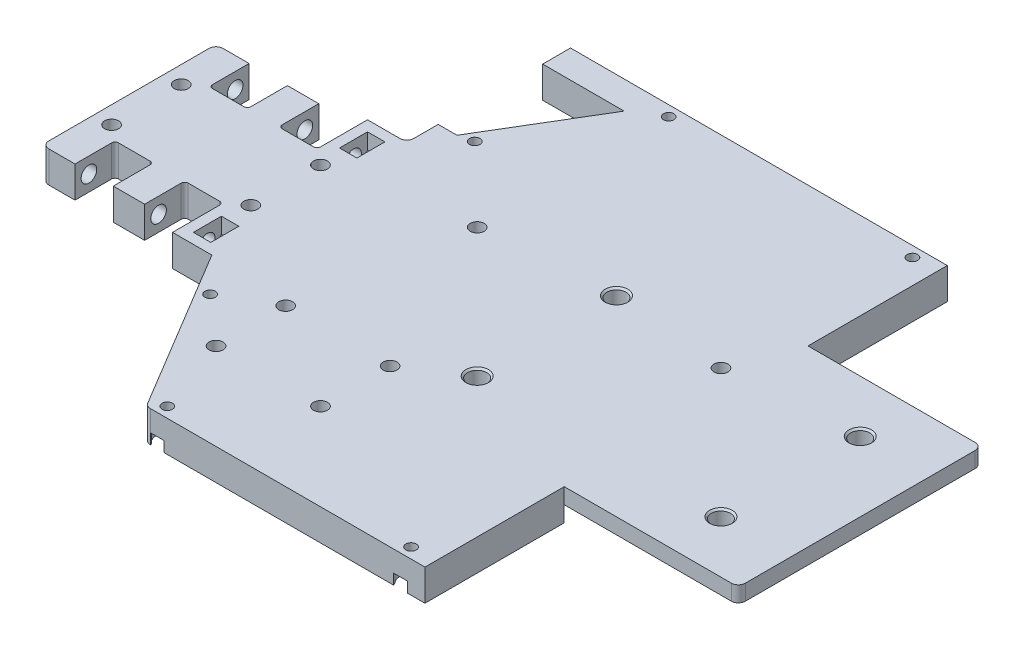
from build123d import *

# Parameters (mm, degrees)
BOSS_EXTRUDE1_DEPTH      = 9
SKETCH3_R                = 2
CUT_EXTRUDE1_DEPTH       = 112.488030158
SKETCH4_W                = 70
SKETCH4_H                = 4.5
BOSS_EXTRUDE2_DEPTH      = 50
SKETCH5_W                = 70
SKETCH5_H                = 4.5
CUT_EXTRUDE2_DEPTH       = 50
SKETCH6_R                = 2.75
CUT_EXTRUDE4_DEPTH       = 50
FILLET1_R                = 2
CHAMFER1_SIZE            = 0.5
FILLET2_R                = 2
SKETCH7_W                = 11
SKETCH7_H                = 11.5
CUT_EXTRUDE5_DEPTH       = 153.08328408
SKETCH8_R                = 2.25
CUT_EXTRUDE6_DEPTH       = 50
SKETCH10_R               = 3.5
CUT_EXTRUDE8_DEPTH       = 4
CUT_EXTRUDE9_START       = -3
CUT_EXTRUDE9_DEPTH       = 5
FILLET4_R                = 1
FILLET4_OF_MIRROR2_R     = 1
SKETCH12_R               = 2
CUT_EXTRUDE10_DEPTH      = 10
SKETCH13_R               = 3.5
CUT_EXTRUDE11_DEPTH      = 3
SKETCH15_R               = 1.5
CUT_EXTRUDE12_DEPTH      = 10
SKETCH17_R               = 3.25
CUT_EXTRUDE14_DEPTH      = 3
CHAMFER2_START           = -1
CHAMFER2_DEPTH           = 4
SKETCH18_W               = 12
SKETCH18_H               = 9
BOSS_EXTRUDE3_DEPTH      = 3
SKETCH20_R               = 2
CUT_EXTRUDE15_DEPTH      = 153.083284086
BOSS_EXTRUDE5_DEPTH      = 3
BOSS_EXTRUDE5_DEPTH_BACK = 26.202556
SKETCH23_W               = 8
SKETCH23_H               = 9
SKETCH23_W_2             = 9
FILLET5_R                = 2
SKETCH24_R               = 3.25
CUT_EXTRUDE17_DEPTH      = 3
SKETCH25_R               = 1.5
CUT_EXTRUDE18_DEPTH      = 152.9352668
SKETCH26_R               = 1.5
CUT_EXTRUDE20_DEPTH      = 5
CHAMFER3_SIZE            = 0.764705882


with BuildPart() as part:
    # Sketch1 → Boss-Extrude1 (new body)
    with BuildSketch(Plane(origin=(0, 0, 0), x_dir=(1, 0, 0), z_dir=(0, 1, 0))):
        Polygon((-78.00255572, 25), (-28.00255572, 25), (1.99744428, 75), (81.99744428, 75), (81.99744428, -75), (1.99744428, -75), (-28.00255572, -25), (-78.00255572, -25), align=None)
    extrude(amount=BOSS_EXTRUDE1_DEPTH)

    # Sketch3 → Cut-Extrude1 (cut, through all)
    with BuildSketch(Plane(origin=(0, 9, 0), x_dir=(1, 0, 0), z_dir=(0, 1, 0))):
        with Locations(Location((-73.00255572, 10, 0), (0, 0, 270))):
            Circle(SKETCH3_R)
        with Locations(Location((-33.00255572, 10, 0), (0, 0, 270))):
            Circle(SKETCH3_R)
        with Locations(Location((-33.00255572, -10, 0), (0, 0, 270))):
            Circle(SKETCH3_R)
        with Locations(Location((-73.00255572, -10, 0), (0, 0, 270))):
            Circle(SKETCH3_R)
    extrude(amount=-CUT_EXTRUDE1_DEPTH, mode=Mode.SUBTRACT)

    # Sketch4 → Boss-Extrude2 (add)
    with BuildSketch(Plane(origin=(81.99744428, 0, 0), x_dir=(0, 0, -1), z_dir=(1, 0, 0))):
        with Locations((0, 6.75)):
            Rectangle(SKETCH4_W, SKETCH4_H)
    extrude(amount=BOSS_EXTRUDE2_DEPTH)

    # Sketch5 → Cut-Extrude2 (cut)
    with BuildSketch(Plane(origin=(81.99744428, 0, 0), x_dir=(0, 0, -1), z_dir=(1, 0, 0))):
        with Locations((0, 2.25)):
            Rectangle(SKETCH5_W, SKETCH5_H)
    extrude(amount=-CUT_EXTRUDE2_DEPTH, mode=Mode.SUBTRACT)

    # Sketch6 → Cut-Extrude4 (cut)
    with BuildSketch(Plane(origin=(0, 9, 0), x_dir=(1, 0, 0), z_dir=(0, 1, 0))):
        with Locations(Location((41.99744428, 20, 0), (0, 0, 270))):
            Circle(SKETCH6_R)
        with Locations(Location((41.99744428, -20, 0), (0, 0, 270))):
            Circle(SKETCH6_R)
        with Locations(Location((111.99744428, 20, 0), (0, 0, 270))):
            Circle(SKETCH6_R)
        with Locations(Location((111.99744428, -20, 0), (0, 0, 270))):
            Circle(SKETCH6_R)
    extrude(amount=-CUT_EXTRUDE4_DEPTH, mode=Mode.SUBTRACT)

    # Fillet1
    fillet1_edges = [part.edges().sort_by_distance(p)[0] for p in [
        (1.99744428, 4.5, 75),
        (-28.00255572, 4.5, 25),
        (-78.00255572, 4.5, 25),
        (-78.00255572, 4.5, -25),
        (-28.00255572, 4.5, -25),
        (1.99744428, 4.5, -75),
    ]]
    fillet(fillet1_edges, radius=FILLET1_R)

    # Chamfer1
    chamfer1_edges = [part.edges().sort_by_distance(p)[0] for p in [
        (41.99744428, 9, 17.25),
        (111.99744428, 9, -22.75),
        (111.99744428, 9, 17.25),
        (41.99744428, 9, -22.75),
    ]]
    chamfer(chamfer1_edges, length=CHAMFER1_SIZE)

    # Fillet2
    fillet2_edges = [part.edges().sort_by_distance(p)[0] for p in [
        (131.99744428, 6.75, 35),
        (131.99744428, 6.75, -35),
    ]]
    fillet(fillet2_edges, radius=FILLET2_R)

    # Sketch7 → Cut-Extrude5 (cut, through all)
    with BuildSketch(Plane(origin=(0, 9, 0), x_dir=(1, 0, 0), z_dir=(0, 1, 0))):
        with Locations((-63.00255572, -19.25)):
            Rectangle(SKETCH7_W, SKETCH7_H)
        with Locations((-43.00255572, -19.25)):
            Rectangle(SKETCH7_W, SKETCH7_H)
    cut_extrude5 = extrude(amount=-CUT_EXTRUDE5_DEPTH, mode=Mode.SUBTRACT)

    # Sketch8 → Cut-Extrude6 (cut)
    with BuildSketch(Plane.ZY.offset(78.00255572)):
        with Locations((21, 4.5)):
            Circle(SKETCH8_R)
    cut_extrude6 = extrude(amount=-CUT_EXTRUDE6_DEPTH, mode=Mode.SUBTRACT)

    # Sketch10 → Cut-Extrude8 (cut)
    with BuildSketch(Plane.ZY.offset(78.00255572)):
        with Locations((21, 4.5)):
            Circle(SKETCH10_R)
    cut_extrude8 = extrude(amount=-CUT_EXTRUDE8_DEPTH, mode=Mode.SUBTRACT)

    # Sketch11 → Cut-Extrude9 (cut)
    with BuildSketch(Plane.ZY.offset(37.50255572).offset(CUT_EXTRUDE9_START)):
        Polygon((16.958548116, 4.5), (16.958548116, 11.77431345), (25.041451884, 11.77431345), (25.041451884, 4.5), (23.020725942, 1), (18.979274058, 1), align=None)
    cut_extrude9 = extrude(amount=-CUT_EXTRUDE9_DEPTH, mode=Mode.SUBTRACT)

    # Fillet4
    fillet4_edges = [part.edges().sort_by_distance(p)[0] for p in [
        (-68.50255572, 4.5, 13.5),
        (-57.50255572, 4.5, 13.5),
        (-48.50255572, 4.5, 13.5),
        (-37.50255572, 4.5, 13.5),
    ]]
    fillet(fillet4_edges, radius=FILLET4_R)

    # Mirror2: Cut-Extrude5, Cut-Extrude6, Cut-Extrude8, Cut-Extrude9 across plane
    add(cut_extrude5.mirror(Plane.XY), mode=Mode.SUBTRACT)
    add(cut_extrude6.mirror(Plane.XY), mode=Mode.SUBTRACT)
    add(cut_extrude8.mirror(Plane.XY), mode=Mode.SUBTRACT)
    add(cut_extrude9.mirror(Plane.XY), mode=Mode.SUBTRACT)

    # Fillet4 of Mirror2
    fillet4_of_mirror2_edges = [part.edges().sort_by_distance(p)[0] for p in [
        (-68.50255572, 4.5, -13.5),
        (-57.50255572, 4.5, -13.5),
        (-48.50255572, 4.5, -13.5),
        (-37.50255572, 4.5, -13.5),
    ]]
    fillet(fillet4_of_mirror2_edges, radius=FILLET4_OF_MIRROR2_R)

    # Sketch12 → Cut-Extrude10 (cut)
    with BuildSketch(Plane(origin=(0, 9, 0), x_dir=(1, 0, 0), z_dir=(0, 1, 0))):
        with Locations(Location((-3.00255572, -30, 0), (0, 0, 270))):
            Circle(SKETCH12_R)
        with Locations(Location((26.99744428, -30, 0), (0, 0, 270))):
            Circle(SKETCH12_R)
        with Locations(Location((-3.00255572, -50, 0), (0, 0, 270))):
            Circle(SKETCH12_R)
        with Locations(Location((26.99744428, -50, 0), (0, 0, 270))):
            Circle(SKETCH12_R)
    extrude(amount=-CUT_EXTRUDE10_DEPTH, mode=Mode.SUBTRACT)

    # Sketch13 → Cut-Extrude11 (cut)
    with BuildSketch(Plane.XZ):
        with Locations(Location((-3.00255572, 50, 0), (0, 0, 270))):
            Circle(SKETCH13_R)
        with Locations(Location((26.99744428, 50, 0), (0, 0, 270))):
            Circle(SKETCH13_R)
        with Locations(Location((26.99744428, 30, 0), (0, 0, 270))):
            Circle(SKETCH13_R)
        with Locations(Location((-3.00255572, 30, 0), (0, 0, 270))):
            Circle(SKETCH13_R)
    extrude(amount=-CUT_EXTRUDE11_DEPTH, mode=Mode.SUBTRACT)

    # Sketch15 → Cut-Extrude12 (cut)
    with BuildSketch(Plane(origin=(0, 9, 0), x_dir=(1, 0, 0), z_dir=(0, 1, 0))):
        with Locations(Location((74.99744428, 72, 0), (0, 0, 270))):
            Circle(SKETCH15_R)
        with Locations(Location((4.99744428, 72, 0), (0, 0, 270))):
            Circle(SKETCH15_R)
        with Locations(Location((-16.703984583, 38, 0), (0, 0, 270))):
            Circle(SKETCH15_R)
        with Locations(Location((-16.703984583, -38, 0), (0, 0, 270))):
            Circle(SKETCH15_R)
        with Locations(Location((4.99744428, -72, 0), (0, 0, 270))):
            Circle(SKETCH15_R)
        with Locations(Location((74.99744428, -72, 0), (0, 0, 270))):
            Circle(SKETCH15_R)
    extrude(amount=-CUT_EXTRUDE12_DEPTH, mode=Mode.SUBTRACT)

    # Sketch17 → Cut-Extrude14 (cut)
    with BuildSketch(Plane.XZ):
        with Locations((4.99744428, 72)):
            Circle(SKETCH17_R)
        with Locations((-16.703984583, 38)):
            Circle(SKETCH17_R)
        with Locations((74.99744428, 72)):
            Circle(SKETCH17_R)
        with Locations((74.99744428, -72)):
            Circle(SKETCH17_R)
        with Locations((-16.703984583, -38)):
            Circle(SKETCH17_R)
        with Locations((4.99744428, -72)):
            Circle(SKETCH17_R)
    extrude(amount=-CUT_EXTRUDE14_DEPTH, mode=Mode.SUBTRACT)

    # Chamfer2: read off the stored shape, not the designer's step
    # Chamfer2 outline → Chamfer2 (cut)
    with BuildSketch(Plane(origin=(0, 0, 0), x_dir=(1, 0, 0), z_dir=(0, 1, 0)).offset(CHAMFER2_START)):
        with BuildLine():
            Line((7.305136588, 74.288461538), (7.012150163, 75))
            Line((7.012150163, 75), (6.24744428, 75))
            ThreePointArc((6.24744428, 75), (6.81151853, 74.696596858), (7.305136588, 74.288461538))
        make_face()
        with BuildLine():
            Line((73.74744428, 75), (72.982738398, 75))
            Line((72.982738398, 75), (72.689751972, 74.288461538))
            ThreePointArc((72.689751972, 74.288461538), (73.18337003, 74.696596858), (73.74744428, 75))
        make_face()
        with BuildLine():
            Line((3.24843319, 75), (2.994690649, 74.559585492))
            ThreePointArc((2.994690649, 74.559585492), (3.35622742, 74.805157254), (3.74744428, 75))
            Line((3.74744428, 75), (3.24843319, 75))
        make_face()
        with BuildLine():
            ThreePointArc((76.24744428, 75), (76.81151853, 74.696596858), (77.305136588, 74.288461538))
            Line((77.305136588, 74.288461538), (77.012150163, 75))
            Line((77.012150163, 75), (76.24744428, 75))
        make_face()
        with BuildLine():
            Line((-19.85362206, -37.198573919), (-20.313020985, -37.815891225))
            Line((-20.313020985, -37.815891225), (-19.919583054, -38.471621109))
            ThreePointArc((-19.919583054, -38.471621109), (-19.949630814, -37.831831801), (-19.85362206, -37.198573919))
        make_face()
        with BuildLine():
            Line((-18.239905735, -41.271083308), (-17.479026266, -41.156233576))
            ThreePointArc((-17.479026266, -41.156233576), (-18.082963811, -40.942943473), (-18.633343666, -40.615353423))
            Line((-18.633343666, -40.615353423), (-18.239905735, -41.271083308))
        make_face()
        with BuildLine():
            Line((76.24744428, -75), (77.012150163, -75))
            Line((77.012150163, -75), (77.305136588, -74.288461538))
            ThreePointArc((77.305136588, -74.288461538), (76.81151853, -74.696596858), (76.24744428, -75))
        make_face()
        with BuildLine():
            Line((6.24744428, -75), (7.012150163, -75))
            Line((7.012150163, -75), (7.305136588, -74.288461538))
            ThreePointArc((7.305136588, -74.288461538), (6.81151853, -74.696596858), (6.24744428, -75))
        make_face()
        with BuildLine():
            ThreePointArc((73.74744428, -75), (73.18337003, -74.696596858), (72.689751972, -74.288461538))
            Line((72.689751972, -74.288461538), (72.982738398, -75))
            Line((72.982738398, -75), (73.74744428, -75))
        make_face()
        with BuildLine():
            ThreePointArc((3.74744428, -75), (3.35622742, -74.805157254), (2.994690649, -74.559585492))
            Line((2.994690649, -74.559585492), (3.24843319, -75))
            Line((3.24843319, -75), (3.74744428, -75))
        make_face()
    extrude(amount=CHAMFER2_DEPTH, mode=Mode.SUBTRACT)

    # Sketch18 → Boss-Extrude3 (add)
    with BuildSketch(Plane.XY.offset(25)):
        with Locations((-31.50255572, 4.5)):
            Rectangle(SKETCH18_W, SKETCH18_H)
    boss_extrude3 = extrude(amount=BOSS_EXTRUDE3_DEPTH)

    # Mirror3: Boss-Extrude3 across plane
    add(boss_extrude3.mirror(Plane.XY))

    # Sketch20 → Cut-Extrude15 (cut, through all)
    with BuildSketch(Plane(origin=(0, 9, 0), x_dir=(1, 0, 0), z_dir=(0, 1, 0))):
        with Locations(Location((4.99744428, 17, 0), (0, 0, 270))):
            Circle(SKETCH20_R)
        with Locations(Location((74.99744428, 17, 0), (0, 0, 270))):
            Circle(SKETCH20_R)
    extrude(amount=-CUT_EXTRUDE15_DEPTH, mode=Mode.SUBTRACT)

    # Sketch23 → Boss-Extrude5 (add, two sides: drawn at the far end of the back side and taken through both)
    with BuildSketch(Plane(origin=(0, 0, 0), x_dir=(0, 0, -1), z_dir=(1, 0, 0)).offset(-BOSS_EXTRUDE5_DEPTH_BACK)):
        with Locations((71, 4.5)):
            Rectangle(SKETCH23_W, SKETCH23_H)
        with Locations((32.5, 4.5)):
            Rectangle(SKETCH23_W_2, SKETCH23_H)
    extrude(amount=BOSS_EXTRUDE5_DEPTH + BOSS_EXTRUDE5_DEPTH_BACK)

    # Fillet5
    fillet5_edges = [part.edges().sort_by_distance(p)[0] for p in [
        (-26.20255572, 4.5, -28),
    ]]
    fillet(fillet5_edges, radius=FILLET5_R)

    # Sketch24 → Cut-Extrude17 (cut)
    with BuildSketch(Plane.XZ):
        with Locations((4.99744428, -72)):
            Circle(SKETCH24_R)
        with Locations((-16.703984583, -38)):
            Circle(SKETCH24_R)
    extrude(amount=-CUT_EXTRUDE17_DEPTH, mode=Mode.SUBTRACT)

    # Sketch25 → Cut-Extrude18 (cut, through all)
    with BuildSketch(Plane.XZ.offset(-3)):
        with Locations(Location((-16.703984583, -38, 0), (0, 0, 90))):
            Circle(SKETCH25_R)
    extrude(amount=-CUT_EXTRUDE18_DEPTH, mode=Mode.SUBTRACT)

    # Sketch26 → Cut-Extrude20 (cut)
    with BuildSketch(Plane.ZY.offset(26.20255572)):
        with Locations((-70, 4.5)):
            Circle(SKETCH26_R)
        with Locations((-33, 4.5)):
            Circle(SKETCH26_R)
    extrude(amount=-CUT_EXTRUDE20_DEPTH, mode=Mode.SUBTRACT)

    # Chamfer3
    # the kernel refuses this chamfer: 1, 0.764705882 mm, written as the material it takes off along each edge
    with BuildSketch(Plane(origin=(-18.633343666, 3, -40.615353423), x_dir=(0.5144957554275292, 0, -0.8574929257125425), z_dir=(0, -1, 0))) as chamfer3_piece_1:
        with BuildLine():
            Line((CHAMFER3_SIZE, 0), (1.057692308, 0.711538462))
            ThreePointArc((1.057692308, 0.711538462), (0.578179192, 0.312945694), (0, 0))
            Line((0, 0), (CHAMFER3_SIZE, 0))
        make_face()
    extrude(amount=6.270562656, mode=Mode.SUBTRACT)
    with BuildSketch(Plane(origin=(-19.919583054, 3, -38.471621109), x_dir=(-0.5144957554275258, 0, 0.8574929257125445), z_dir=(0, -1, 0))) as chamfer3_piece_2:
        with BuildLine():
            Line((CHAMFER3_SIZE, 0), (1.057692308, -0.711538462))
            ThreePointArc((1.057692308, -0.711538462), (0.578179192, -0.312945694), (0, 0))
            Line((0, 0), (CHAMFER3_SIZE, 0))
        make_face()
    extrude(amount=6.270562656, mode=Mode.SUBTRACT)


solid = part.part
